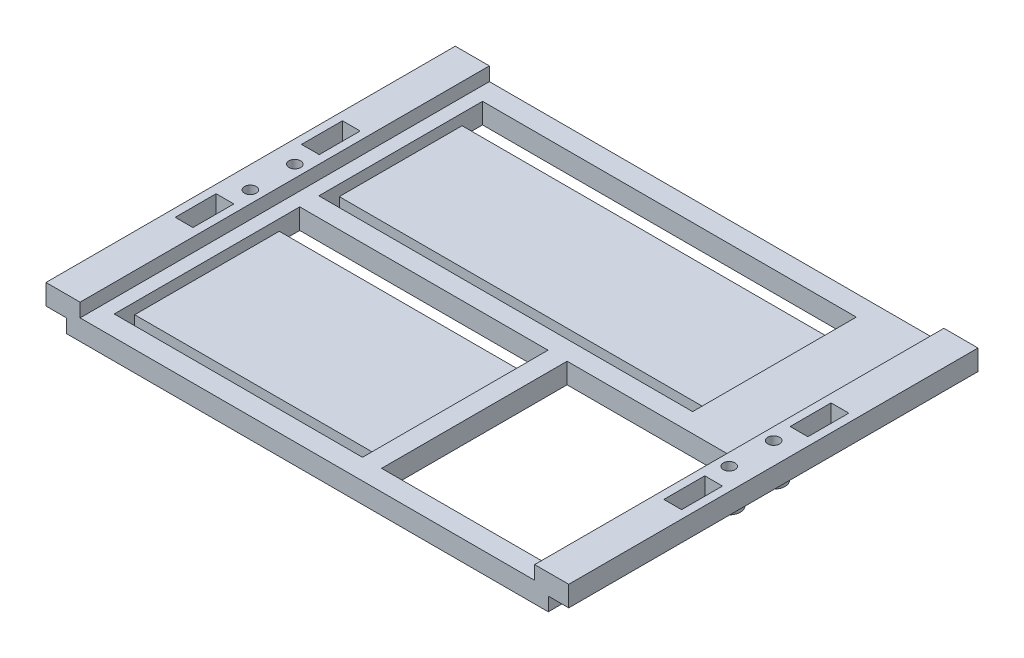
from build123d import *

# Parameters (mm, degrees)
PLATEFRAME_DEPTH          = 150
SKETCH3_R                 = 2.5
HOLESUPPORT_DEPTH         = 244.653052515
SKETCH4_R                 = 4.15
SKETCH4_R_2               = 2.15
CYLINDRICALSUPPORTS_DEPTH = 12.5
SKETCH8_W                 = 137
SKETCH8_H                 = 60
SKETCH8_W_2               = 91
SKETCH8_H_2               = 68
ITEMLAYOUT_DEPTH          = 4
SKETCH9_W                 = 58.6
SKETCH9_H                 = 68
HOLECUTOUT_DEPTH          = 7.5
SKETCH10_W                = 91
SKETCH10_H                = 7.5
SKETCH10_W_2              = 137
VELCROCUT_DEPTH           = 3.5
SKETCH11_W                = 6.5
SKETCH11_H                = 15
CUTSHELLHOLES_DEPTH       = 12.5


with BuildPart() as part:
    # Sketch2 → PlateFrame (new body)
    with BuildSketch(Plane.XY):
        Polygon((179.1, 12.5), (191.6, 12.5), (191.6, 5), (184.1, 5), (184.1, 0), (7.5, 0), (7.5, 5), (0, 5), (0, 12.5), (12.5, 12.5), (12.5, 7.5), (179.1, 7.5), align=None)
    extrude(amount=PLATEFRAME_DEPTH)

    # Sketch3 → HoleSupport (cut, through all)
    with BuildSketch(Plane(origin=(0, 12.5, 0), x_dir=(1, 0, 0), z_dir=(0, 1, 0))):
        with Locations((8.05, -66.85)):
            Circle(SKETCH3_R)
        with Locations((8.05, -83.15)):
            Circle(SKETCH3_R)
        with Locations((183.55, -66.85)):
            Circle(SKETCH3_R)
        with Locations((183.55, -83.15)):
            Circle(SKETCH3_R)
    extrude(amount=-HOLESUPPORT_DEPTH, mode=Mode.SUBTRACT)

    # Sketch4 → CylindricalSupports (add)
    # profile 1 of 4: a face of its own
    with BuildSketch(Plane(origin=(0, 12.5, 0), x_dir=(1, 0, 0), z_dir=(0, 1, 0))):
        with Locations((183.55, -66.85)):
            Circle(SKETCH4_R)
        with Locations((183.55, -66.85)):
            Circle(SKETCH4_R_2, mode=Mode.SUBTRACT)
    # profile 2 of 4: a face of its own
    with BuildSketch(Plane(origin=(0, 12.5, 0), x_dir=(1, 0, 0), z_dir=(0, 1, 0))):
        with Locations((183.55, -83.15)):
            Circle(SKETCH4_R)
        with Locations((183.55, -83.15)):
            Circle(SKETCH4_R_2, mode=Mode.SUBTRACT)
    # profile 3 of 4: a face of its own
    with BuildSketch(Plane(origin=(0, 12.5, 0), x_dir=(1, 0, 0), z_dir=(0, 1, 0))):
        with Locations((8.05, -66.85)):
            Circle(SKETCH4_R)
        with Locations((8.05, -66.85)):
            Circle(SKETCH4_R_2, mode=Mode.SUBTRACT)
    # profile 4 of 4: a face of its own
    with BuildSketch(Plane(origin=(0, 12.5, 0), x_dir=(1, 0, 0), z_dir=(0, 1, 0))):
        with Locations((8.05, -83.15)):
            Circle(SKETCH4_R)
        with Locations((8.05, -83.15)):
            Circle(SKETCH4_R_2, mode=Mode.SUBTRACT)
    extrude(amount=-CYLINDRICALSUPPORTS_DEPTH)

    # Sketch8 → ItemLayout (cut)
    with BuildSketch(Plane(origin=(0, 7.5, 0), x_dir=(1, 0, 0), z_dir=(0, 1, 0))):
        with Locations((86, -37.5)):
            Rectangle(SKETCH8_W, SKETCH8_H)
        with Locations((63, -108.5)):
            Rectangle(SKETCH8_W_2, SKETCH8_H_2)
    extrude(amount=-ITEMLAYOUT_DEPTH, mode=Mode.SUBTRACT)

    # Sketch9 → HoleCutout (cut)
    with BuildSketch(Plane(origin=(0, 7.5, 0), x_dir=(1, 0, 0), z_dir=(0, 1, 0))):
        with Locations((144.8, -108.5)):
            Rectangle(SKETCH9_W, SKETCH9_H)
    extrude(amount=-HOLECUTOUT_DEPTH, mode=Mode.SUBTRACT)

    # Sketch10 → VelcroCut (cut)
    with BuildSketch(Plane(origin=(0, 3.5, 0), x_dir=(1, 0, 0), z_dir=(0, 1, 0))):
        with Locations((63, -78.25)):
            Rectangle(SKETCH10_W, SKETCH10_H)
        with Locations((63, -138.75)):
            Rectangle(SKETCH10_W, SKETCH10_H)
        with Locations((86, -11.25)):
            Rectangle(SKETCH10_W_2, SKETCH10_H)
        with Locations((86, -63.75)):
            Rectangle(SKETCH10_W_2, SKETCH10_H)
    extrude(amount=-VELCROCUT_DEPTH, mode=Mode.SUBTRACT)

    # Sketch11 → CutShellHoles (cut)
    with BuildSketch(Plane(origin=(0, 12.5, 0), x_dir=(1, 0, 0), z_dir=(0, 1, 0))):
        with Locations((6.25, -51.85)):
            Rectangle(SKETCH11_W, SKETCH11_H)
        with Locations((185.35, -51.85)):
            Rectangle(SKETCH11_W, SKETCH11_H)
        with Locations((185.35, -98.15)):
            Rectangle(SKETCH11_W, SKETCH11_H)
        with Locations((6.25, -98.15)):
            Rectangle(SKETCH11_W, SKETCH11_H)
    extrude(amount=-CUTSHELLHOLES_DEPTH, mode=Mode.SUBTRACT)


solid = part.part
